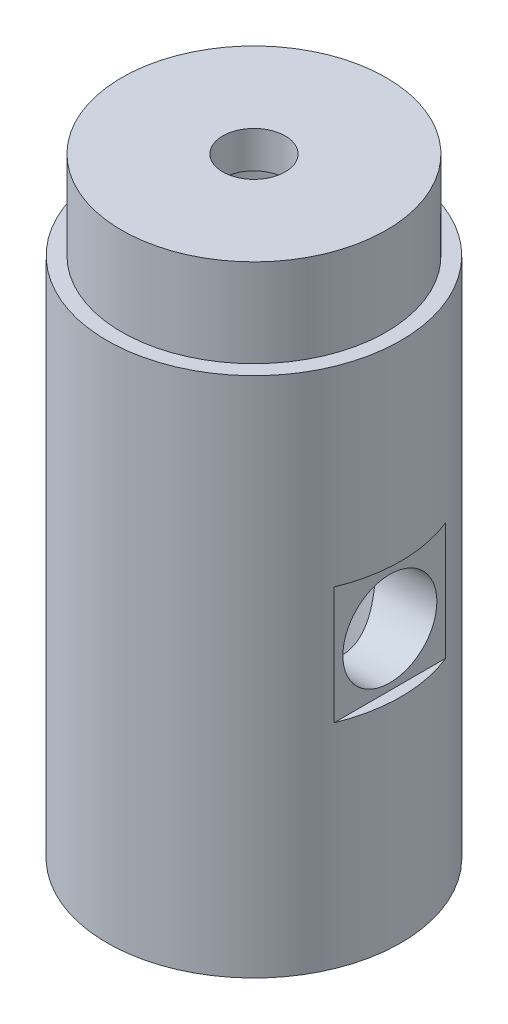
from build123d import *

# Parameters (mm, degrees)
TAGLIO_ESTRUSIONE1_START = 20
SCHIZZO2_W               = 16
SCHIZZO2_H               = 16
TAGLIO_ESTRUSIONE1_DEPTH = 1.5


with BuildPart() as part:
    # Schizzo1 → Rivoluzione1 (revolve)
    with BuildSketch(Plane.XY):
        Polygon((-12, 0), (-20, 0), (-20, 71), (-18, 71), (-18, 83), (-4.25, 83), (-4.25, 78), (-12, 78), align=None)
    revolve(axis=Axis((0, 0, 0), (0, 1, 0)))

    # Schizzo2 → Taglio-Estrusione1 (cut)
    with BuildSketch(Plane(origin=(0, 0, 0), x_dir=(0, 0, -1), z_dir=(1, 0, 0)).offset(TAGLIO_ESTRUSIONE1_START)):
        with Locations((0, 37)):
            Rectangle(SCHIZZO2_W, SCHIZZO2_H)
    taglio_estrusione1 = extrude(amount=-TAGLIO_ESTRUSIONE1_DEPTH, mode=Mode.SUBTRACT)

    # Schizzo4 → Foro Ø12.8 (12.8)-1 (revolve, cut)
    with BuildSketch(Plane(origin=(18.5, 36.304872912, 0), x_dir=(0, 0, -1), z_dir=(0, 1, 0))):
        Polygon((0, 0), (0, 19), (6.4, 15.154492038), (6.4, 0), align=None)
    foro_12_8_12_8_1 = revolve(axis=Axis((24.85, 36.304872912, 0), (-1, 0, 0)), mode=Mode.SUBTRACT)

    # Specchia1: Taglio-Estrusione1, Foro Ø12.8 (12.8)-1 across plane
    add(taglio_estrusione1.mirror(Plane(origin=(0, 0, 0), x_dir=(0, 0, 1), z_dir=(1, 0, 0))), mode=Mode.SUBTRACT)
    add(foro_12_8_12_8_1.mirror(Plane(origin=(0, 0, 0), x_dir=(0, 0, 1), z_dir=(1, 0, 0))), mode=Mode.SUBTRACT)


solid = part.part
